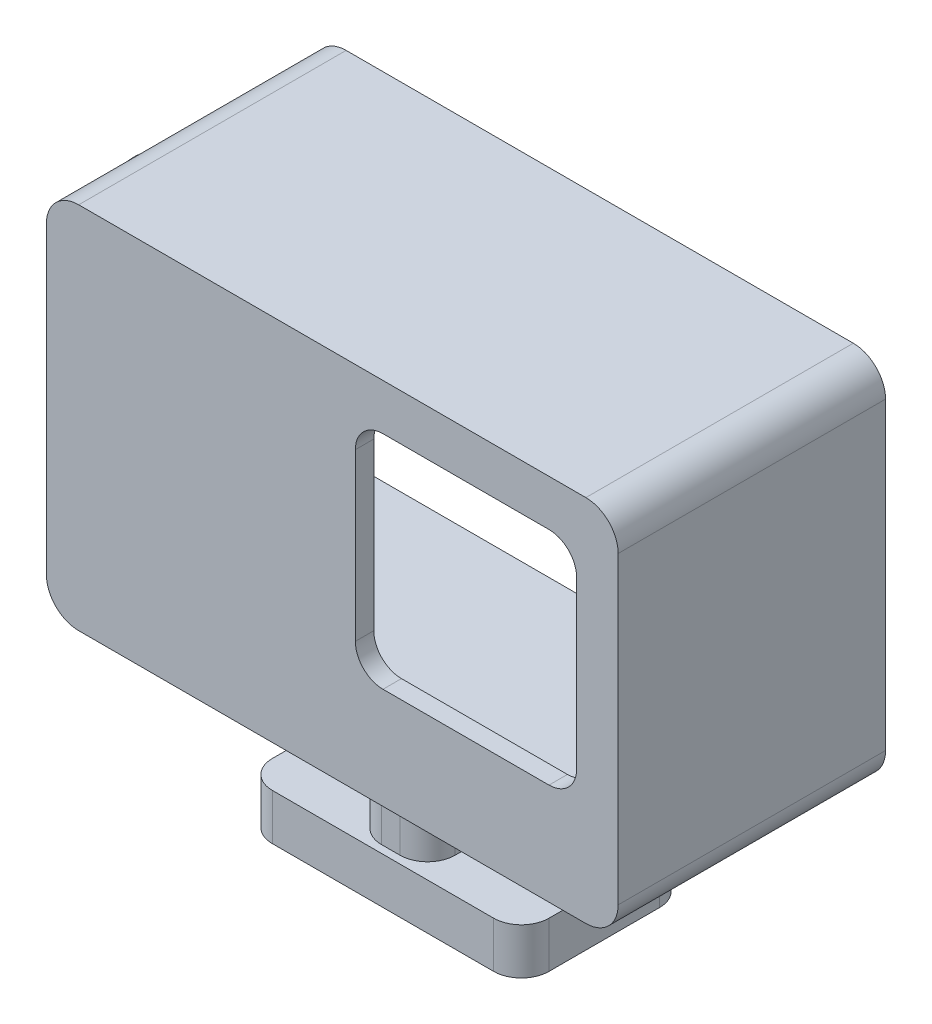
from build123d import *

# Parameters (mm, degrees)
BOSS_EXTRUDE1_DEPTH = 27
BOSS_EXTRUDE2_START = 2
BOSS_EXTRUDE2_DEPTH = 2
SKETCH3_W           = 8
SKETCH3_H           = 16
BOSS_EXTRUDE3_DEPTH = 10
SKETCH4_W           = 30
SKETCH4_H           = 18
BOSS_EXTRUDE4_DEPTH = 5
FILLET1_R           = 3
FILLET2_R           = 3
SKETCH5_R           = 3
BOSS_EXTRUDE5_DEPTH = 32
SKETCH6_R           = 4.5
BOSS_EXTRUDE6_DEPTH = 5
SKETCH7_R           = 5
BOSS_EXTRUDE7_DEPTH = 5


with BuildPart() as part:
    # Sketch1 → Boss-Extrude1 (new body)
    with BuildSketch(Plane.XY):
        with BuildLine():
            Line((31, 80), (31, 47))
            ThreePointArc((31, 47), (29.974873734, 44.525126266), (27.5, 43.5))
            Line((27.5, 43.5), (-27.5, 43.5))
            ThreePointArc((-27.5, 43.5), (-29.974873734, 44.525126266), (-31, 47))
            Line((-31, 47), (-31, 80))
            ThreePointArc((-31, 80), (-29.974873734, 82.474873734), (-27.5, 83.5))
            Line((-27.5, 83.5), (27.5, 83.5))
            ThreePointArc((27.5, 83.5), (29.974873734, 82.474873734), (31, 80))
        make_face()
        with BuildLine():
            Line((29.5, 80), (29.5, 47))
            ThreePointArc((29.5, 47), (28.914213562, 45.585786438), (27.5, 45))
            Line((27.5, 45), (-27.5, 45))
            ThreePointArc((-27.5, 45), (-28.914213562, 45.585786438), (-29.5, 47))
            Line((-29.5, 47), (-29.5, 80))
            ThreePointArc((-29.5, 80), (-28.914213562, 81.414213562), (-27.5, 82))
            Line((-27.5, 82), (27.5, 82))
            ThreePointArc((27.5, 82), (28.914213562, 81.414213562), (29.5, 80))
        make_face(mode=Mode.SUBTRACT)
    extrude(amount=-BOSS_EXTRUDE1_DEPTH)

    # Sketch2 → Boss-Extrude2 (add)
    with BuildSketch(Plane.XY.offset(BOSS_EXTRUDE2_START)):
        with BuildLine():
            Line((27.5, 83.5), (-27.5, 83.5))
            ThreePointArc((-27.5, 83.5), (-29.974873734, 82.474873734), (-31, 80))
            Line((-31, 80), (-31, 47))
            ThreePointArc((-31, 47), (-29.974873734, 44.525126266), (-27.5, 43.5))
            Line((-27.5, 43.5), (27.5, 43.5))
            ThreePointArc((27.5, 43.5), (29.974873734, 44.525126266), (31, 47))
            Line((31, 47), (31, 80))
            ThreePointArc((31, 80), (29.974873734, 82.474873734), (27.5, 83.5))
        make_face()
        with BuildLine():
            Line((23.5, 78.5), (5.5, 78.5))
            ThreePointArc((5.5, 78.5), (3.378679656, 77.621320344), (2.5, 75.5))
            Line((2.5, 75.5), (2.5, 57.5))
            ThreePointArc((2.5, 57.5), (3.378679656, 55.378679656), (5.5, 54.5))
            Line((5.5, 54.5), (23.5, 54.5))
            ThreePointArc((23.5, 54.5), (25.621320344, 55.378679656), (26.5, 57.5))
            Line((26.5, 57.5), (26.5, 75.5))
            ThreePointArc((26.5, 75.5), (25.621320344, 77.621320344), (23.5, 78.5))
        make_face(mode=Mode.SUBTRACT)
    extrude(amount=-BOSS_EXTRUDE2_DEPTH)

    # Sketch3 → Boss-Extrude3 (add)
    with BuildSketch(Plane.XZ.offset(-43.5)):
        with Locations((0, -12.332332162)):
            Rectangle(SKETCH3_W, SKETCH3_H)
    extrude(amount=BOSS_EXTRUDE3_DEPTH)

    # Sketch4 → Boss-Extrude4 (add)
    with BuildSketch(Plane.XZ.offset(-33.5)):
        with Locations((0, -12.5)):
            Rectangle(SKETCH4_W, SKETCH4_H)
    extrude(amount=BOSS_EXTRUDE4_DEPTH)

    # Fillet1
    fillet1_edges = [part.edges().sort_by_distance(p)[0] for p in [
        (-15, 31, -21.5),
        (15, 31, -21.5),
        (-15, 31, -3.5),
        (15, 31, -3.5),
    ]]
    fillet(fillet1_edges, radius=FILLET1_R)

    # Fillet2
    fillet2_edges = [part.edges().sort_by_distance(p)[0] for p in [
        (4, 38.5, -4.332332162),
        (-4, 38.5, -4.332332162),
        (-4, 38.5, -20.332332162),
        (4, 38.5, -20.332332162),
    ]]
    fillet(fillet2_edges, radius=FILLET2_R)

    # Sketch5 → Boss-Extrude5 (add)
    with BuildSketch(Plane.ZY.offset(4)):
        with Locations((-12.5, 38.5)):
            Circle(SKETCH5_R)
    extrude(amount=BOSS_EXTRUDE5_DEPTH)

    # Sketch6 → Boss-Extrude6 (add)
    with BuildSketch(Plane.ZY.offset(36)):
        with Locations((-12.5, 38.5)):
            Circle(SKETCH6_R)
    extrude(amount=BOSS_EXTRUDE6_DEPTH)

    # Sketch7 → Boss-Extrude7 (add)
    with BuildSketch(Plane.ZY.offset(31)):
        with Locations((-12.5, 71.5)):
            Circle(SKETCH7_R)
        with Locations((-12.5, 56.5)):
            Circle(SKETCH7_R)
    extrude(amount=BOSS_EXTRUDE7_DEPTH)


solid = part.part
